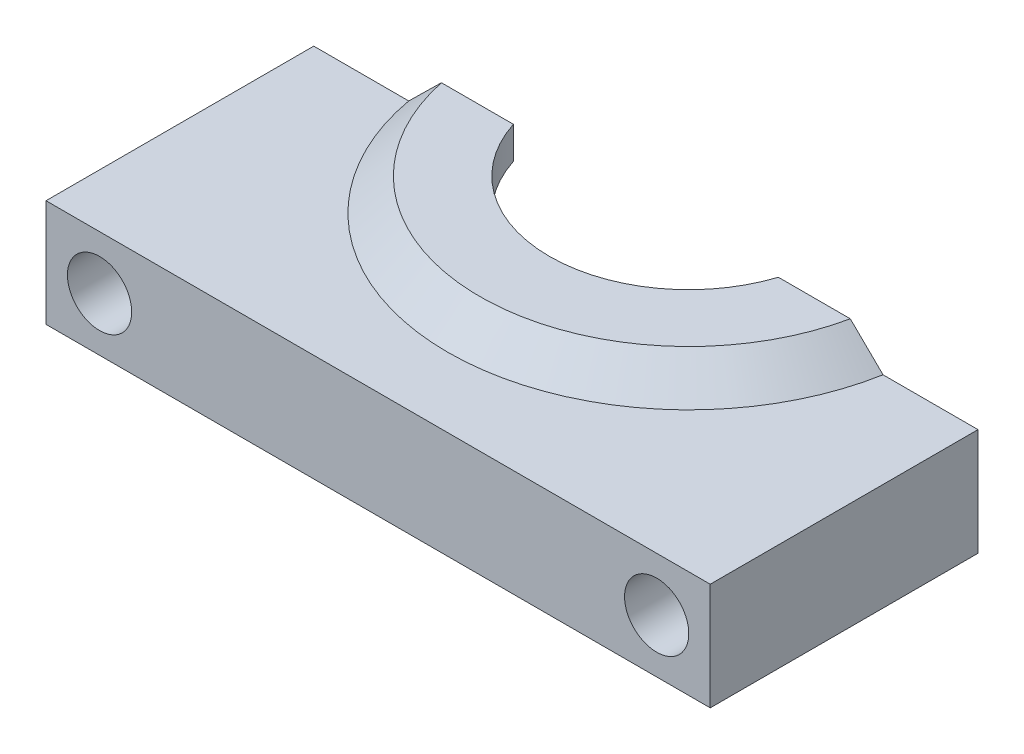
from build123d import *

# Parameters (mm, degrees)
BOSS_EXTRUDE1_DEPTH = 10
SKETCH2_R           = 3
CUT_EXTRUDE1_DEPTH  = 27
SKETCH4_R           = 19.5
SKETCH4_R_2         = 13
BOSS_EXTRUDE2_DEPTH = 3
CUT_EXTRUDE2_DEPTH  = 8
CHAMFER1_SIZE       = 3
SKETCH6_W           = 41.436134758
SKETCH6_H           = 7.128250764
CUT_EXTRUDE3_DEPTH  = 5
FILLET1_R           = 3.65


# Some blends are built 0.0001 mm under size
with BuildPart() as part:
    # Sketch1 → Boss-Extrude1 (new body)
    with BuildSketch(Plane(origin=(0, 0, 0), x_dir=(1, 0, 0), z_dir=(0, 1, 0))):
        with BuildLine():
            Line((-16.306566162, -4), (-31.007810594, -4))
            Line((-31.007810594, -4), (-31.007810594, -29))
            Line((-31.007810594, -29), (-22, -29))
            Line((-22, -29), (22, -29))
            Line((22, -29), (31.007810594, -29))
            Line((31.007810594, -29), (31.007810594, -4))
            Line((31.007810594, -4), (16.306566162, -4))
            ThreePointArc((16.306566162, -4), (0, -16.79), (-16.306566162, -4))
        make_face()
    extrude(amount=BOSS_EXTRUDE1_DEPTH)

    # Sketch2 → Cut-Extrude1 (cut)
    with BuildSketch(Plane(origin=(0, 0, 4), x_dir=(-1, 0, 0), z_dir=(0, 0, -1))):
        with Locations((-26.007810594, 5)):
            Circle(SKETCH2_R)
        with Locations((26.007810594, 5)):
            Circle(SKETCH2_R)
    extrude(amount=-CUT_EXTRUDE1_DEPTH, mode=Mode.SUBTRACT)

    # Sketch4 → Boss-Extrude2 (add)
    with BuildSketch(Plane(origin=(0, 10, 0), x_dir=(1, 0, 0), z_dir=(0, 1, 0))):
        with Locations(Location((0, 0, 0), (0, 0, 348.162995844))):
            Circle(SKETCH4_R)
        with Locations(Location((0, 0, 0), (0, 0, 270))):
            Circle(SKETCH4_R_2, mode=Mode.SUBTRACT)
    extrude(amount=BOSS_EXTRUDE2_DEPTH)

    # Sketch5 → Cut-Extrude2 (cut)
    with BuildSketch(Plane(origin=(0, 13, 0), x_dir=(1, 0, 0), z_dir=(0, 1, 0))):
        Polygon((-19.085334684, -4), (-23.625672229, -4), (-23.625672229, 24.113520256), (25.409917146, 24.113520256), (25.409917146, -4), align=None)
    extrude(amount=-CUT_EXTRUDE2_DEPTH, mode=Mode.SUBTRACT)

    # Chamfer1
    chamfer1_edges = [part.edges().sort_by_distance(p)[0] for p in [
        (0, 10, 19.5),
    ]]
    chamfer(chamfer1_edges, length=CHAMFER1_SIZE - 0.0001)  # a hair under: the kernel refuses the full size

    # Sketch6 → Cut-Extrude3 (cut)
    with BuildSketch(Plane.XZ):
        with Locations((0, 22.895)):
            Rectangle(SKETCH6_W, SKETCH6_H)
    extrude(amount=-CUT_EXTRUDE3_DEPTH, mode=Mode.SUBTRACT)

    # Fillet1
    # the kernel refuses this fillet: 3.65 mm, written as the material it adds along each edge
    with BuildSketch(Plane(origin=(-20.718067379, 0, 19.330874618), x_dir=(0, 0, 1), z_dir=(0, 1, 0))) as fillet1_piece_1:
        with BuildLine():
            CenterArc((FILLET1_R, FILLET1_R), FILLET1_R, 180, 90)
            Line((0, FILLET1_R), (0, 0))
            Line((0, 0), (FILLET1_R, 0))
        make_face()
    extrude(amount=5)
    with BuildSketch(Plane(origin=(-20.718067379, 0, 26.459125382), x_dir=(0, 0, -1), z_dir=(0, 1, 0)), Plane(origin=(20.718067379, 0, 26.459125382), x_dir=(-1, 0, 0), z_dir=(0, 1, 0)), Plane(origin=(20.718067379, 0, 19.330874618), x_dir=(0, 0, 1), z_dir=(0, 1, 0))) as fillet1_piece_2:
        with BuildLine():
            CenterArc((FILLET1_R, -FILLET1_R), FILLET1_R, 90, 90)
            Line((0, -FILLET1_R), (0, 0))
            Line((0, 0), (FILLET1_R, 0))
        make_face()
    extrude(amount=5)


solid = part.part
